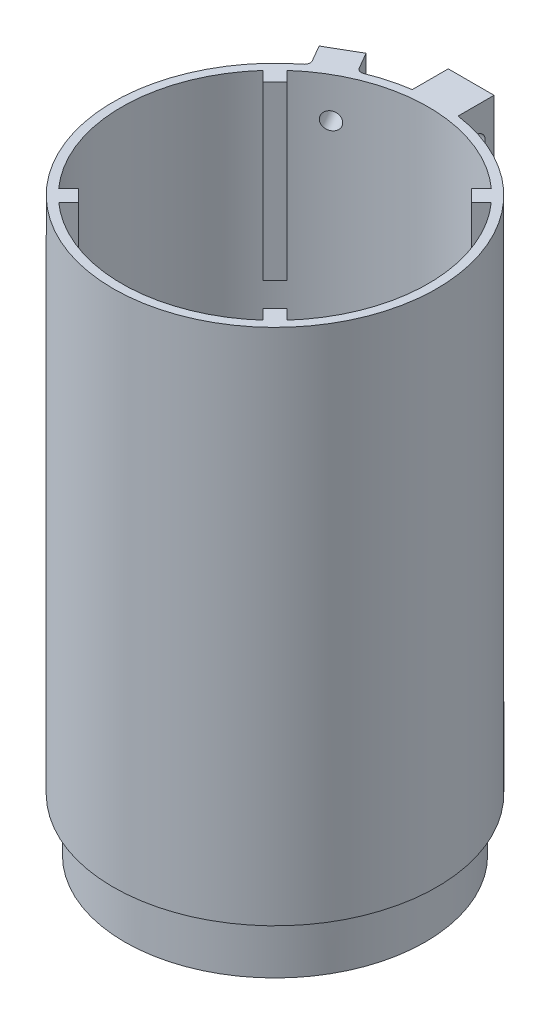
from build123d import *
from build123d.topology import SkipClean

# Parameters (mm, degrees)
SKIZZE1_R                            = 26.25
SKIZZE1_R_2                          = 25.75
AUFSATZ_LINEAR_AUSTRAGEN1_DEPTH      = 9.8
SKIZZE2_R                            = 28.25
SKIZZE2_R_2                          = 26.75
AUFSATZ_LINEAR_AUSTRAGEN2_DEPTH      = 90
SKIZZE4_W                            = 8
SKIZZE4_H                            = 7.091913552
AUFSATZ_LINEAR_AUSTRAGEN4_DEPTH      = 10
SKIZZE5_R                            = 28.25
SKIZZE5_R_2                          = 25.25
AUFSATZ_LINEAR_AUSTRAGEN5_DEPTH      = 0.5
SKIZZE6_R                            = 1.6
SCHNITT_LINEAR_AUSTRAGEN1_DEPTH      = 111.332066962
AUFSATZ_LINEAR_AUSTRAGEN6_DEPTH      = 30
FASE1_SIZE                           = 2
FASE2_SIZE                           = 6.5
SKIZZE9_R                            = 1.5
SCHNITT_LINEAR_AUSTRAGEN3_DEPTH      = 10
AUFSATZ_LINEAR_AUSTRAGEN7_DEPTH      = 4
AUFSATZ_LINEAR_AUSTRAGEN7_DEPTH_BACK = 1
SKIZZE12_R                           = 1.5
SCHNITT_LINEAR_AUSTRAGEN4_DEPTH      = 10
VERRUNDUNG1_R                        = 1
VERRUNDUNG2_R                        = 1


with BuildPart() as part:
    # Skizze1 → Aufsatz-Linear austragen1 (new body)
    with BuildSketch(Plane(origin=(0, 0, 0), x_dir=(1, 0, 0), z_dir=(0, 1, 0))):
        with Locations(Location((0, 0, 0), (0, 0, 270))):
            Circle(SKIZZE1_R)
        with Locations(Location((0, 0, 0), (0, 0, 270))):
            Circle(SKIZZE1_R_2, mode=Mode.SUBTRACT)
    extrude(amount=AUFSATZ_LINEAR_AUSTRAGEN1_DEPTH)



with BuildPart() as body_2:
    # Skizze2 → Aufsatz-Linear austragen2 (new body)
    with BuildSketch(Plane(origin=(0, 9.8, 0), x_dir=(1, 0, 0), z_dir=(0, 1, 0))):
        with Locations(Location((0, 0, 0), (0, 0, 90))):
            Circle(SKIZZE2_R)
        with Locations(Location((0, 0, 0), (0, 0, 90))):
            Circle(SKIZZE2_R_2, mode=Mode.SUBTRACT)
    extrude(amount=AUFSATZ_LINEAR_AUSTRAGEN2_DEPTH)

    # Skizze4 → Aufsatz-Linear austragen4 (add)
    with BuildSketch(Plane(origin=(0, 99.8, 0), x_dir=(1, 0, 0), z_dir=(0, 1, 0))):
        with Locations((0, 30.704043224)):
            Rectangle(SKIZZE4_W, SKIZZE4_H)
    extrude(amount=-AUFSATZ_LINEAR_AUSTRAGEN4_DEPTH)


with BuildPart() as part_1:
    with SkipClean():  # the faces are left unmerged after this step: merging them gives an invalid solid
        add(part.part)

        add(body_2.part)  # Aufsatz-Linear austragen5 merges body 2
        # Skizze5 → Aufsatz-Linear austragen5 (add)
        with BuildSketch(Plane.XZ.offset(-9.8)):
            with Locations(Location((0, 0, 0), (0, 0, 278.140032175))):
                Circle(SKIZZE5_R)
            with Locations(Location((0, 0, 0), (0, 0, 270))):
                Circle(SKIZZE5_R_2, mode=Mode.SUBTRACT)
        extrude(amount=AUFSATZ_LINEAR_AUSTRAGEN5_DEPTH)

    # Skizze6 → Schnitt-Linear austragen1 (cut, through all)
    with SkipClean():  # the faces are left unmerged after this step: merging them gives an invalid solid
        with BuildSketch(Plane.ZY.offset(4)):
            with Locations((-31.107690192, 93.8)):
                Circle(SKIZZE6_R)
        extrude(amount=-SCHNITT_LINEAR_AUSTRAGEN1_DEPTH, mode=Mode.SUBTRACT)

    # Skizze7 → Aufsatz-Linear austragen6 (add)
    with SkipClean():  # the faces are left unmerged after this step: merging them gives an invalid solid
        with BuildSketch(Plane(origin=(0, 99.8, 0), x_dir=(1, 0, 0), z_dir=(0, 1, 0))):
            Polygon((-17.824684675, 19.946005019), (-16.086679272, 18.207999616), (-18.207999616, 16.086679272), (-19.946005019, 17.824684675), (-19.438254624, 19.438254624), align=None)
            Polygon((19.438254624, 19.438254624), (17.824684675, 19.946005019), (16.086679272, 18.207999616), (18.207999616, 16.086679272), (19.946005019, 17.824684675), align=None)
            Polygon((17.824684675, -19.946005019), (16.086679272, -18.207999616), (18.207999616, -16.086679272), (19.946005019, -17.824684675), (19.438254624, -19.438254624), align=None)
            Polygon((-19.438254624, -19.438254624), (-17.824684675, -19.946005019), (-16.086679272, -18.207999616), (-18.207999616, -16.086679272), (-19.946005019, -17.824684675), align=None)
        extrude(amount=-AUFSATZ_LINEAR_AUSTRAGEN6_DEPTH)

    # Fase1
    # the kernel refuses this chamfer: 2 mm, written as the material it adds along each edge
    with BuildSketch(Plane(origin=(0, 9.8, 0), x_dir=(0, 0, -1), z_dir=(1, 0, 0))) as fase1_piece_1_section:
        Polygon((26.75, FASE1_SIZE), (26.75 - FASE1_SIZE, 0), (26.75, 0), align=None)
    fase1_piece_1 = revolve(axis=Axis((0, 9.8, 0), (0, 1, 0)), mode=Mode.PRIVATE)
    fase1_piece_1 = fase1_piece_1 - Plane(origin=(0, 11.029190239, 0), x_dir=(0, 0, -1), z_dir=(0, 1, 0)) * Cylinder(25.25, 107, mode=Mode.PRIVATE)
    add(fase1_piece_1)

    # Fase2
    # the kernel refuses this chamfer: 6.5 mm, written as the material it adds along each edge
    with BuildSketch(Plane(origin=(0, 89.8, 0), x_dir=(-0.6696868042546434, 0, -0.7426436455038196), z_dir=(-0.7426436455038196, 0, 0.6696868042546434))) as fase2_piece_1_section:
        Polygon((28.25, FASE2_SIZE), (28.25 + FASE2_SIZE, 0), (28.25, 0), align=None)
    fase2_piece_1 = revolve(axis=Axis((0, 89.8, 0), (0, -1, 0)), revolution_arc=42.042896807, mode=Mode.PRIVATE)
    fase2_piece_1 = split(fase2_piece_1, bisect_by=Plane(origin=(-4, 87.632301808, -30.259261886), z_dir=(1, 0, 0)), keep=Keep.TOP, mode=Mode.PRIVATE)
    fase2_piece_1 = split(fase2_piece_1, bisect_by=Plane(origin=(-2.005219876, 87.632301808, -34.25), z_dir=(0, 0, 1)), keep=Keep.TOP, mode=Mode.PRIVATE)
    with BuildSketch(Plane(origin=(0, 89.8, 0), x_dir=(0, 0, -1), z_dir=(-1, 0, 0))) as fase2_piece_2_section:
        Polygon((28.25, FASE2_SIZE), (28.25 + FASE2_SIZE, 0), (28.25, 0), align=None)
    fase2_piece_2 = revolve(axis=Axis((0, 89.8, 0), (0, -1, 0)), revolution_arc=42.042896807, mode=Mode.PRIVATE)
    fase2_piece_2 = split(fase2_piece_2, bisect_by=Plane(origin=(4, 87.632301812, -30.25926189), z_dir=(-1, 0, 0)), keep=Keep.TOP, mode=Mode.PRIVATE)
    fase2_piece_2 = split(fase2_piece_2, bisect_by=Plane(origin=(2.005219877, 87.632301812, -34.25), z_dir=(0, 0, 1)), keep=Keep.TOP, mode=Mode.PRIVATE)
    add([fase2_piece_1, fase2_piece_2])

    # Skizze9 → Schnitt-Linear austragen3 (cut)
    with BuildSketch(Plane(origin=(-14.125, 0, -24.465217657), x_dir=(0, 1, 0), z_dir=(-0.500000000000001, 0, -0.866025403784438))):
        with Locations(Location((92.8, 0, 0), (0, 0, 270))):
            Circle(SKIZZE9_R)
    extrude(amount=-SCHNITT_LINEAR_AUSTRAGEN3_DEPTH, mode=Mode.SUBTRACT)

    # Skizze11 → Aufsatz-Linear austragen7 (add, two sides: drawn at the far end of the back side and taken through both)
    with BuildSketch(Plane(origin=(-14.125, 0, -24.465217657), x_dir=(0, 1, 0), z_dir=(-0.500000000000001, 0, -0.866025403784438)).offset(-AUFSATZ_LINEAR_AUSTRAGEN7_DEPTH_BACK)):
        Polygon((95.8, 3), (99.8, 3), (99.8, -3), (95.8, -3), (89.8, -3), (89.8, 3), align=None)
    extrude(amount=AUFSATZ_LINEAR_AUSTRAGEN7_DEPTH + AUFSATZ_LINEAR_AUSTRAGEN7_DEPTH_BACK)

    # Skizze12 → Schnitt-Linear austragen4 (cut)
    with BuildSketch(Plane(origin=(-16.125, 0, -27.929319272), x_dir=(-0.866025403784438, 0, 0.5000000000000012), z_dir=(-0.5000000000000011, 0, -0.8660254037844379))):
        with Locations((0, 92.8)):
            Circle(SKIZZE12_R)
    extrude(amount=-SCHNITT_LINEAR_AUSTRAGEN4_DEPTH, mode=Mode.SUBTRACT)

    # Verrundung1
    verrundung1_edges = [part_1.edges().sort_by_distance(p)[0] for p in [
        (-12.486987868, 89.8, -27.628097421),
        (-17.683140291, 89.8, -24.628097421),
    ]]
    fillet(verrundung1_edges, radius=VERRUNDUNG1_R)

    # Verrundung2
    verrundung2_edges = [part_1.edges().sort_by_distance(p)[0] for p in [
        (-16.64320437, 95.3, -22.82687557),
        (-11.447051948, 95.3, -25.82687557),
        (-14.125, 89.8, -24.465217657),
        (-11.716058882, 90.092363035, -25.705961648),
        (-16.403986386, 90.09236302, -22.999385442),
    ]]
    fillet(verrundung2_edges, radius=VERRUNDUNG2_R)


solid = part_1.part
